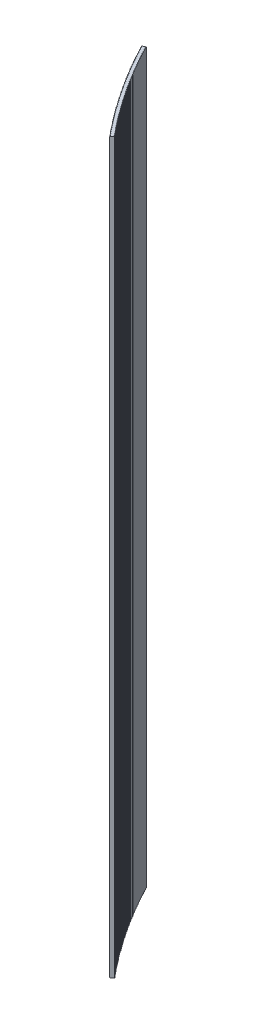
from build123d import *

# Parameters (mm, degrees)
EXTRUDE_3_DEPTH          = 2000
CUT_EXTRUDE_1_DEPTH      = 30
PATTERN_CIRCULAR_1_COUNT = 4
PATTERN_CIRCULAR_1_ANGLE = 9.99
CUT_EXTRUDE_START        = -2000
CUT_EXTRUDE_4_DEPTH      = 2000


# Read off the part's stored shape, not the designer's step: 切除-拉伸4
with BuildPart() as part:
    # 草图1 → 凸台-拉伸3 (new body)
    with BuildSketch(Plane(origin=(0, 0, 0), x_dir=(1, 0, 0), z_dir=(0, 1, 0))):
        with BuildLine():
            Line((-1145.538694667, -944.968834947), (-1137.824629383, -938.605408449))
            ThreePointArc((-1137.824629383, -938.605408449), (-1229.702487971, -814.528569836), (-1308.107468768, -681.527585761))
            Line((-1308.107468768, -681.527585761), (-1316.97599398, -686.148111766))
            ThreePointArc((-1316.97599398, -686.148111766), (-1238.039453991, -820.050797428), (-1145.538694667, -944.968834947))
        make_face()
    extrude(amount=EXTRUDE_3_DEPTH)

    # 草图2 → 切除-拉伸1 (cut)
    with BuildSketch(Plane(origin=(0, 0, 0), x_dir=(1, 0, 0), z_dir=(0, 1, 0))):
        with BuildLine():
            Line((-1303.208186932, -699.349284345), (-1304.970469808, -700.294989936))
            ThreePointArc((-1304.970469808, -700.294989936), (-1301.285862357, -707.118168647), (-1297.565579497, -713.921961355))
            Line((-1297.565579497, -713.921961355), (-1295.813296472, -712.957853373))
            ThreePointArc((-1295.813296472, -712.957853373), (-1299.528555318, -706.16324877), (-1303.208186932, -699.349284345))
        make_face()
    cut_extrude_1 = extrude(amount=CUT_EXTRUDE_1_DEPTH, mode=Mode.SUBTRACT)

    # 阵列(圆周)1: 切除-拉伸1 ×4 about axis
    pattern_circular_1_axis = Axis((0, 0, 0), (0, 1, 0))
    for i in range(1, PATTERN_CIRCULAR_1_COUNT):
        add(cut_extrude_1.rotate(pattern_circular_1_axis, i * PATTERN_CIRCULAR_1_ANGLE / (PATTERN_CIRCULAR_1_COUNT - 1)), mode=Mode.SUBTRACT)

    # 切除-拉伸4 outline → 切除-拉伸4 (cut)
    with BuildSketch(Plane.XZ.offset(CUT_EXTRUDE_START)):
        with BuildLine():
            ThreePointArc((-1308.107468768, 681.527585761), (-1306.617494344, 684.37980937), (-1305.121300885, 687.228775573))
            Line((-1305.121300885, 687.228775573), (-1308.107468768, 685.160227829))
            Line((-1308.107468768, 685.160227829), (-1308.107468768, 681.527585761))
        make_face()
        with BuildLine():
            ThreePointArc((-1305.057495235, 687.349935717), (-1303.554825683, 690.195491465), (-1302.045951672, 693.037762127))
            Line((-1302.045951672, 693.037762127), (-1305.041307655, 690.982541718))
            Line((-1305.041307655, 690.982541718), (-1305.057495235, 687.349935717))
        make_face()
        with BuildLine():
            ThreePointArc((-1301.981606749, 693.158636741), (-1300.466271907, 695.997468122), (-1298.944747307, 698.832986803))
            Line((-1298.944747307, 698.832986803), (-1301.94923191, 696.791134541))
            Line((-1301.94923191, 696.791134541), (-1301.981606749, 693.158636741))
        make_face()
        with BuildLine():
            ThreePointArc((-1298.879864387, 698.953573487), (-1297.351894346, 701.785624131), (-1295.81774937, 704.614334524))
            Line((-1295.81774937, 704.614334524), (-1298.831302933, 702.585890954))
            Line((-1298.831302933, 702.585890954), (-1298.879864387, 698.953573487))
        make_face()
        with BuildLine():
            ThreePointArc((-1295.752329743, 704.734630883), (-1294.211754844, 707.559844552), (-1292.665019957, 710.381690488))
            Line((-1292.665019957, 710.381690488), (-1295.687582638, 708.366695889))
            Line((-1295.687582638, 708.366695889), (-1295.752329743, 704.734630883))
        make_face()
        with BuildLine():
            ThreePointArc((-1292.599064921, 710.501694133), (-1291.045915756, 713.320014727), (-1289.486621671, 716.13494017))
            Line((-1289.486621671, 716.13494017), (-1292.51813345, 714.133434555))
            Line((-1292.51813345, 714.133434555), (-1292.599064921, 710.501694133))
        make_face()
        with BuildLine():
            ThreePointArc((-1289.420132536, 716.254648718), (-1287.854439947, 719.066020272), (-1286.282617627, 721.873969326))
            Line((-1286.282617627, 721.873969326), (-1289.323018307, 719.885992439))
            Line((-1289.323018307, 719.885992439), (-1289.420132536, 716.254648718))
        make_face()
        with BuildLine():
            ThreePointArc((-1286.215595714, 721.9933804), (-1284.637390791, 724.797747087), (-1283.053071449, 727.598663994))
            Line((-1283.053071449, 727.598663994), (-1286.102300654, 725.624255312))
            Line((-1286.102300654, 725.624255312), (-1286.215595714, 721.9933804))
        make_face()
        with BuildLine():
            ThreePointArc((-1282.985518088, 727.717775224), (-1281.394832169, 730.515081357), (-1279.798047265, 733.308910498))
            Line((-1279.798047265, 733.308910498), (-1282.856044448, 731.348109226))
            Line((-1282.856044448, 731.348109226), (-1282.985518088, 727.717775224))
        make_face()
        with BuildLine():
            ThreePointArc((-1279.729963799, 733.427719517), (-1278.126828471, 736.21790955), (-1276.517609713, 739.004595447))
            Line((-1276.517609713, 739.004595447), (-1279.584314149, 737.057440522))
            Line((-1279.584314149, 737.057440522), (-1279.729963799, 733.427719517))
        make_face()
        with BuildLine():
            ThreePointArc((-1276.448997493, 739.123099896), (-1274.833444591, 741.906118423), (-1273.211823934, 744.685605739))
            Line((-1273.211823934, 744.685605739), (-1276.287174726, 742.752135827))
            Line((-1276.287174726, 742.752135827), (-1276.448997493, 739.123099896))
        make_face()
        with BuildLine():
            ThreePointArc((-1273.142684321, 744.803803266), (-1271.514745925, 747.579595023), (-1269.88075557, 750.351828566))
            Line((-1269.88075557, 750.351828566), (-1272.964691651, 748.43208206))
            Line((-1272.964691651, 748.43208206), (-1273.142684321, 744.803803266))
        make_face()
        with BuildLine():
            ThreePointArc((-1269.811089939, 750.469716823), (-1268.170798376, 753.23822669), (-1266.524470769, 756.003151411))
            Line((-1266.524470769, 756.003151411), (-1269.616930899, 754.097166432))
            Line((-1269.616930899, 754.097166432), (-1269.811089939, 750.469716823))
        make_face()
        with BuildLine():
            ThreePointArc((-1266.454280502, 756.120728058), (-1264.801668343, 758.88190106), (-1263.143036177, 761.639462054))
            Line((-1263.143036177, 761.639462054), (-1266.243958948, 759.74727645))
            Line((-1266.243958948, 759.74727645), (-1266.454280502, 756.120728058))
        make_face()
        with BuildLine():
            ThreePointArc((-1263.072322668, 761.756724755), (-1261.40742273, 764.510506064), (-1259.73651894, 767.260648573))
            Line((-1259.73651894, 767.260648573), (-1262.845842777, 765.382299917))
            Line((-1262.845842777, 765.382299917), (-1263.072322668, 761.756724755))
        make_face()
        with BuildLine():
            ThreePointArc((-1259.665283594, 767.377595001), (-1257.988128937, 770.123929932), (-1256.304986703, 772.866599347))
            Line((-1256.304986703, 772.866599347), (-1259.422649862, 771.002124938))
            Line((-1259.422649862, 771.002124938), (-1259.665283594, 767.377595001))
        make_face()
        with BuildLine():
            ThreePointArc((-1256.233230934, 772.983227178), (-1254.543854862, 775.722061197), (-1252.848507607, 778.457203055))
            Line((-1252.848507607, 778.457203055), (-1255.97444818, 776.606639917))
            Line((-1255.97444818, 776.606639917), (-1256.233230934, 772.983227178))
        make_face()
        with BuildLine():
            ThreePointArc((-1252.776232839, 778.573509974), (-1251.074668899, 781.304788696), (-1249.367150288, 784.032348684))
            Line((-1249.367150288, 784.032348684), (-1252.501306203, 782.195733565))
            Line((-1252.501306203, 782.195733565), (-1252.776232839, 778.573509974))
        make_face()
        with BuildLine():
            ThreePointArc((-1249.294357958, 784.148332381), (-1247.580639938, 786.87200157), (-1245.860983876, 789.591925526))
            Line((-1245.860983876, 789.591925526), (-1249.003292897, 787.769294895))
            Line((-1249.003292897, 787.769294895), (-1249.294357958, 784.148332381))
        make_face()
        with BuildLine():
            ThreePointArc((-1245.787675428, 789.707583699), (-1244.061837359, 792.423589268), (-1242.330077996, 795.135823182))
            Line((-1242.330077996, 795.135823182), (-1245.480477723, 793.327213233))
            Line((-1245.480477723, 793.327213233), (-1245.787675428, 789.707583699))
        make_face()
        with BuildLine():
            ThreePointArc((-1242.256254886, 795.251153534), (-1240.518331037, 797.959441553), (-1238.77450276, 800.663931567))
            Line((-1238.77450276, 800.663931567), (-1241.932930637, 798.869378212))
            Line((-1241.932930637, 798.869378212), (-1242.256254886, 795.251153534))
        make_face()
        with BuildLine():
            ThreePointArc((-1238.700166455, 800.778931807), (-1236.950191336, 803.479448495), (-1235.194328774, 806.176140906))
            Line((-1235.194328774, 806.176140906), (-1238.360722082, 804.395679781))
            Line((-1238.360722082, 804.395679781), (-1238.700166455, 800.778931807))
        make_face()
        with BuildLine():
            ThreePointArc((-1235.119480749, 806.29080875), (-1233.357489111, 808.983500483), (-1231.58962713, 811.672341741))
            Line((-1231.58962713, 811.672341741), (-1234.763922992, 809.906008202))
            Line((-1234.763922992, 809.906008202), (-1235.119480749, 806.29080875))
        make_face()
        with BuildLine():
            ThreePointArc((-1231.514268872, 811.786674913), (-1229.740295703, 814.471488221), (-1227.960469407, 817.152424933))
            Line((-1227.960469407, 817.152424933), (-1231.142604792, 815.400254054))
            Line((-1231.142604792, 815.400254054), (-1231.514268872, 811.786674913))
        make_face()
        with BuildLine():
            ThreePointArc((-1227.884602412, 817.266421163), (-1226.098682939, 819.943302732), (-1224.306927672, 822.616281662))
            Line((-1224.306927672, 822.616281662), (-1227.49683939, 820.878308237))
            Line((-1227.49683939, 820.878308237), (-1227.884602412, 817.266421163))
        make_face()
        with BuildLine():
            ThreePointArc((-1224.230553446, 822.729938686), (-1222.432723133, 825.398835361), (-1220.629074473, 828.06380343))
            Line((-1220.629074473, 828.06380343), (-1223.826699181, 826.34006197))
            Line((-1223.826699181, 826.34006197), (-1224.230553446, 822.729938686))
        make_face()
        with BuildLine():
            ThreePointArc((-1220.552194533, 828.177118991), (-1218.74248908, 830.837977775), (-1216.926982844, 833.494882065))
            Line((-1216.926982844, 833.494882065), (-1220.132257046, 831.785406798))
            Line((-1220.132257046, 831.785406798), (-1220.552194533, 828.177118991))
        make_face()
        with BuildLine():
            ThreePointArc((-1216.849598717, 833.607853912), (-1215.028054058, 836.260621967), (-1213.200726297, 838.909409718))
            Line((-1213.200726297, 838.909409718), (-1216.413586344, 837.214234592))
            Line((-1216.413586344, 837.214234592), (-1216.849598717, 833.607853912))
        make_face()
        with BuildLine():
            ThreePointArc((-1213.122839519, 839.022035609), (-1211.289491827, 841.666660259), (-1209.450378826, 844.307278873))
            Line((-1209.450378826, 844.307278873), (-1212.67076092, 842.626437548))
            Line((-1212.67076092, 842.626437548), (-1213.122839519, 839.022035609))
        make_face()
        with BuildLine():
            ThreePointArc((-1209.371990944, 844.419556571), (-1207.526876624, 847.0559853), (-1205.676014903, 849.688382342))
            Line((-1205.676014903, 849.688382342), (-1208.903855096, 848.021908195))
            Line((-1208.903855096, 848.021908195), (-1209.371990944, 844.419556571))
        make_face()
        with BuildLine():
            ThreePointArc((-1205.597127474, 849.800309618), (-1203.740283164, 852.428490073), (-1201.877709478, 855.052613271))
            Line((-1201.877709478, 855.052613271), (-1205.112943673, 853.400539394))
            Line((-1205.112943673, 853.400539394), (-1205.597127474, 849.800309618))
        make_face()
        with BuildLine():
            ThreePointArc((-1201.798324067, 855.164187902), (-1199.92978664, 857.784067895), (-1198.055537973, 860.399865141))
            Line((-1198.055537973, 860.399865141), (-1201.298101927, 858.762224339))
            Line((-1201.298101927, 858.762224339), (-1201.798324067, 855.164187902))
        make_face()
        with BuildLine():
            ThreePointArc((-1197.975656158, 860.51108491), (-1196.095462718, 863.122612418), (-1194.209576287, 865.730031768))
            Line((-1194.209576287, 865.730031768), (-1197.459405612, 864.106856562))
            Line((-1197.459405612, 864.106856562), (-1197.975656158, 860.51108491))
        make_face()
        with BuildLine():
            ThreePointArc((-1194.129199654, 865.840894468), (-1192.237387536, 868.444017632), (-1190.339900791, 871.043007311))
            Line((-1190.339900791, 871.043007311), (-1193.596930954, 869.434329931))
            Line((-1193.596930954, 869.434329931), (-1194.129199654, 865.840894468))
        make_face()
        with BuildLine():
            ThreePointArc((-1190.259030936, 871.153510741), (-1188.355637707, 873.74817787), (-1186.446588326, 876.338686268))
            Line((-1186.446588326, 876.338686268), (-1189.710754651, 874.744538659))
            Line((-1189.710754651, 874.744538659), (-1190.259030936, 871.153510741))
        make_face()
        with BuildLine():
            ThreePointArc((-1186.365226854, 876.448828233), (-1184.45029031, 879.034987805), (-1182.529716203, 881.616963481))
            Line((-1182.529716203, 881.616963481), (-1185.800953872, 880.037377299))
            Line((-1185.800953872, 880.037377299), (-1186.365226854, 876.448828233))
        make_face()
        with BuildLine():
            ThreePointArc((-1182.44786473, 881.726741794), (-1180.521422897, 884.304342454), (-1178.5893622, 886.877734138))
            Line((-1178.5893622, 886.877734138), (-1181.867606255, 885.312740748))
            Line((-1181.867606255, 885.312740748), (-1182.44786473, 881.726741794))
        make_face()
        with BuildLine():
            ThreePointArc((-1178.507022353, 886.987146618), (-1176.569113484, 889.556137182), (-1174.625604563, 892.120893773))
            Line((-1174.625604563, 892.120893773), (-1177.910789907, 890.570524252))
            Line((-1177.910789907, 890.570524252), (-1178.507022353, 886.987146618))
        make_face()
        with BuildLine():
            ThreePointArc((-1174.542777975, 892.229938249), (-1172.593440552, 894.790267702), (-1170.638522001, 897.346338271))
            Line((-1170.638522001, 897.346338271), (-1173.930583398, 895.810623406))
            Line((-1173.930583398, 895.810623406), (-1174.542777975, 892.229938249))
        make_face()
        with BuildLine():
            ThreePointArc((-1170.555210317, 897.455012577), (-1168.594483049, 900.00663008), (-1166.628193686, 902.55396387))
            Line((-1166.628193686, 902.55396387), (-1169.927065766, 901.032934156))
            Line((-1169.927065766, 901.032934156), (-1170.555210317, 897.455012577))
        make_face()
        with BuildLine():
            ThreePointArc((-1166.544398561, 902.662265848), (-1164.572320383, 905.205120731), (-1162.594699254, 907.743667159))
            Line((-1162.594699254, 907.743667159), (-1165.90031651, 906.237352799))
            Line((-1165.90031651, 906.237352799), (-1166.544398561, 902.662265848))
        make_face()
        with BuildLine():
            ThreePointArc((-1162.510422351, 907.851594659), (-1160.527032423, 910.385636429), (-1158.538118798, 912.915345085))
            Line((-1158.538118798, 912.915345085), (-1161.850415589, 911.423775991))
            Line((-1161.850415589, 911.423775991), (-1162.510422351, 907.851594659))
        make_face()
        with BuildLine():
            ThreePointArc((-1158.453361792, 913.022895963), (-1156.458699499, 915.5480743), (-1154.458532872, 918.068894953))
            Line((-1154.458532872, 918.068894953), (-1157.777443424, 916.592100743))
            Line((-1157.777443424, 916.592100743), (-1158.453361792, 913.022895963))
        make_face()
        with BuildLine():
            ThreePointArc((-1154.373297445, 918.176067073), (-1152.367402395, 920.692331834), (-1150.356022484, 923.204214426))
            Line((-1150.356022484, 923.204214426), (-1153.681480894, 921.742224425))
            Line((-1153.681480894, 921.742224425), (-1154.373297445, 918.176067073))
        make_face()
        with BuildLine():
            ThreePointArc((-1150.270310329, 923.311005661), (-1148.253222354, 925.81830688), (-1146.230669101, 928.321201531))
            Line((-1146.230669101, 928.321201531), (-1149.562609333, 926.874044771))
            Line((-1149.562609333, 926.874044771), (-1150.270310329, 923.311005661))
        make_face()
        with BuildLine():
            ThreePointArc((-1146.14448192, 928.42760976), (-1144.116241074, 930.925897647), (-1142.082554641, 933.419754658))
            Line((-1142.082554641, 933.419754658), (-1145.420910531, 931.987459875))
            Line((-1145.420910531, 931.987459875), (-1146.14448192, 928.42760976))
        make_face()
        with BuildLine():
            ThreePointArc((-1141.995894145, 933.525777768), (-1139.956540703, 936.015002715), (-1137.911761473, 938.499772563))
            Line((-1137.911761473, 938.499772563), (-1141.256466731, 937.082368199))
            Line((-1141.256466731, 937.082368199), (-1141.995894145, 933.525777768))
        make_face()
        with BuildLine():
            Line((-1146.282900866, 941.417406019), (-1145.506181502, 944.94201444))
            Line((-1145.506181502, 944.94201444), (-1145.538694667, 944.968834947))
            ThreePointArc((-1145.538694667, 944.968834947), (-1238.039453991, 820.050797428), (-1316.97599398, 686.148111766))
            Line((-1316.97599398, 686.148111766), (-1313.911072028, 688.381373932))
            Line((-1313.911072028, 688.381373932), (-1313.867490991, 692.037258591))
            Line((-1313.867490991, 692.037258591), (-1310.830499399, 694.229517537))
            Line((-1310.830499399, 694.229517537), (-1310.770627642, 697.885171695))
            Line((-1310.770627642, 697.885171695), (-1307.723897179, 700.0638756))
            Line((-1307.723897179, 700.0638756), (-1307.647735892, 703.719226664))
            Line((-1307.647735892, 703.719226664), (-1304.591327059, 705.884332265))
            Line((-1304.591327059, 705.884332265), (-1304.498877753, 709.539307651))
            Line((-1304.498877753, 709.539307651), (-1301.432851241, 711.690771954))
            Line((-1301.432851241, 711.690771954), (-1301.324115753, 715.345299084))
            Line((-1301.324115753, 715.345299084), (-1298.248532445, 717.483079366))
            Line((-1298.248532445, 717.483079366), (-1298.123512934, 721.13708567))
            Line((-1298.123512934, 721.13708567), (-1295.038433904, 723.261139482))
            Line((-1295.038433904, 723.261139482), (-1294.897132851, 726.914552402))
            Line((-1294.897132851, 726.914552402), (-1291.80261936, 729.024837566))
            Line((-1291.80261936, 729.024837566), (-1291.645039573, 732.677584553))
            Line((-1291.645039573, 732.677584553), (-1288.54115307, 734.774059164))
            Line((-1288.54115307, 734.774059164), (-1288.367297676, 738.426067686))
            Line((-1288.367297676, 738.426067686), (-1285.254099795, 740.508690113))
            Line((-1285.254099795, 740.508690113), (-1285.063972248, 744.159887651))
            Line((-1285.063972248, 744.159887651), (-1281.94152481, 746.228616539))
            Line((-1281.94152481, 746.228616539), (-1281.735128885, 749.87893059))
            Line((-1281.735128885, 749.87893059), (-1278.603493892, 751.933724859))
            Line((-1278.603493892, 751.933724859), (-1278.380833688, 755.583082937))
            Line((-1278.380833688, 755.583082937), (-1275.240073326, 757.623901785))
            Line((-1275.240073326, 757.623901785), (-1275.001153264, 761.272231424))
            Line((-1275.001153264, 761.272231424), (-1271.851329901, 763.299034325))
            Line((-1271.851329901, 763.299034325), (-1271.596154725, 766.946263078))
            Line((-1271.596154725, 766.946263078), (-1268.437330908, 768.959009787))
            Line((-1268.437330908, 768.959009787), (-1268.165905684, 772.60506523))
            Line((-1268.165905684, 772.60506523), (-1264.99814414, 774.603715778))
            Line((-1264.99814414, 774.603715778), (-1264.710474259, 778.248525511))
            Line((-1264.710474259, 778.248525511), (-1261.533837889, 780.233040209))
            Line((-1261.533837889, 780.233040209), (-1261.229929064, 783.876531855))
            Line((-1261.229929064, 783.876531855), (-1258.044480948, 785.846871298))
            Line((-1258.044480948, 785.846871298), (-1257.724339213, 789.488972507))
            Line((-1257.724339213, 789.488972507), (-1254.530142607, 791.445097568))
            Line((-1254.530142607, 791.445097568), (-1254.193774319, 795.085736018))
            Line((-1254.193774319, 795.085736018), (-1250.990892649, 797.027607854))
            Line((-1250.990892649, 797.027607854), (-1250.638304488, 800.666711251))
            Line((-1250.638304488, 800.666711251), (-1247.426801357, 802.594291302))
            Line((-1247.426801357, 802.594291302), (-1247.058000324, 806.231787384))
            Line((-1247.058000324, 806.231787384), (-1243.837939502, 808.145037372))
            Line((-1243.837939502, 808.145037372), (-1243.45293292, 811.780853908))
            Line((-1243.45293292, 811.780853908), (-1240.22437835, 813.679735842))
            Line((-1240.22437835, 813.679735842), (-1239.823173865, 817.313800634))
            Line((-1239.823173865, 817.313800634), (-1236.586189657, 819.198276808))
            Line((-1236.586189657, 819.198276808), (-1236.168795236, 822.830517692))
            Line((-1236.168795236, 822.830517692), (-1232.923445667, 824.700550684))
            Line((-1232.923445667, 824.700550684), (-1232.489869598, 828.330895536))
            Line((-1232.489869598, 828.330895536), (-1229.236219112, 830.186448213))
            Line((-1229.236219112, 830.186448213), (-1228.786470005, 833.814824942))
            Line((-1228.786470005, 833.814824942), (-1225.524583212, 835.655860457))
            Line((-1225.524583212, 835.655860457), (-1225.058669997, 839.282197014))
            Line((-1225.058669997, 839.282197014), (-1221.78861167, 841.108678809))
            Line((-1221.78861167, 841.108678809), (-1221.306543599, 844.732903185))
            Line((-1221.306543599, 844.732903185), (-1218.028378671, 846.544794991))
            Line((-1218.028378671, 846.544794991), (-1217.530165317, 850.166835218))
            Line((-1217.530165317, 850.166835218), (-1214.243958883, 851.964101056))
            Line((-1214.243958883, 851.964101056), (-1213.72961014, 855.58388521))
            Line((-1213.72961014, 855.58388521), (-1210.435427457, 857.366489391))
            Line((-1210.435427457, 857.366489391), (-1209.904953536, 860.983945593))
            Line((-1209.904953536, 860.983945593), (-1206.602860018, 862.75185272))
            Line((-1206.602860018, 862.75185272), (-1206.056271455, 866.366909136))
            Line((-1206.056271455, 866.366909136), (-1202.746332671, 868.120084102))
            Line((-1202.746332671, 868.120084102), (-1202.183640319, 871.732668947))
            Line((-1202.183640319, 871.732668947), (-1198.865921996, 873.47107694))
            Line((-1198.865921996, 873.47107694), (-1198.287137029, 877.081118478))
            Line((-1198.287137029, 877.081118478), (-1194.961705049, 878.804724976))
            Line((-1194.961705049, 878.804724976), (-1194.36683896, 882.412151522))
            Line((-1194.36683896, 882.412151522), (-1191.033759356, 884.1209223))
            Line((-1191.033759356, 884.1209223), (-1190.422823957, 887.725662219))
            Line((-1190.422823957, 887.725662219), (-1187.082162916, 889.419563345))
            Line((-1187.082162916, 889.419563345), (-1186.455170339, 893.021545058))
            Line((-1186.455170339, 893.021545058), (-1183.106994196, 894.700542895))
            Line((-1183.106994196, 894.700542895), (-1182.463956892, 898.299694875))
            Line((-1182.463956892, 898.299694875), (-1179.108332135, 899.963756084))
            Line((-1179.108332135, 899.963756084), (-1178.449262871, 903.560006861))
            Line((-1178.449262871, 903.560006861), (-1175.086256133, 905.209098397))
            Line((-1175.086256133, 905.209098397), (-1174.411167998, 908.80237656))
            Line((-1174.411167998, 908.80237656), (-1171.040846059, 910.436465678))
            Line((-1171.040846059, 910.436465678), (-1170.349752458, 914.026699874))
            Line((-1170.349752458, 914.026699874), (-1166.972182243, 915.645754123))
            Line((-1166.972182243, 915.645754123), (-1166.2650969, 919.23287306))
            Line((-1166.2650969, 919.23287306), (-1162.880345479, 920.836860292))
            Line((-1162.880345479, 920.836860292), (-1162.157282434, 924.420792738))
            Line((-1162.157282434, 924.420792738), (-1158.76541702, 926.009681101))
            Line((-1158.76541702, 926.009681101), (-1158.026390631, 929.59035589))
            Line((-1158.026390631, 929.59035589), (-1154.627478576, 931.164113833))
            Line((-1154.627478576, 931.164113833), (-1153.872503518, 934.741459862))
            Line((-1153.872503518, 934.741459862), (-1150.466612317, 936.300056134))
            Line((-1150.466612317, 936.300056134), (-1149.695703582, 939.874002367))
            Line((-1149.695703582, 939.874002367), (-1146.282900866, 941.417406019))
        make_face()
    extrude(amount=CUT_EXTRUDE_4_DEPTH, mode=Mode.SUBTRACT)


solid = part.part
